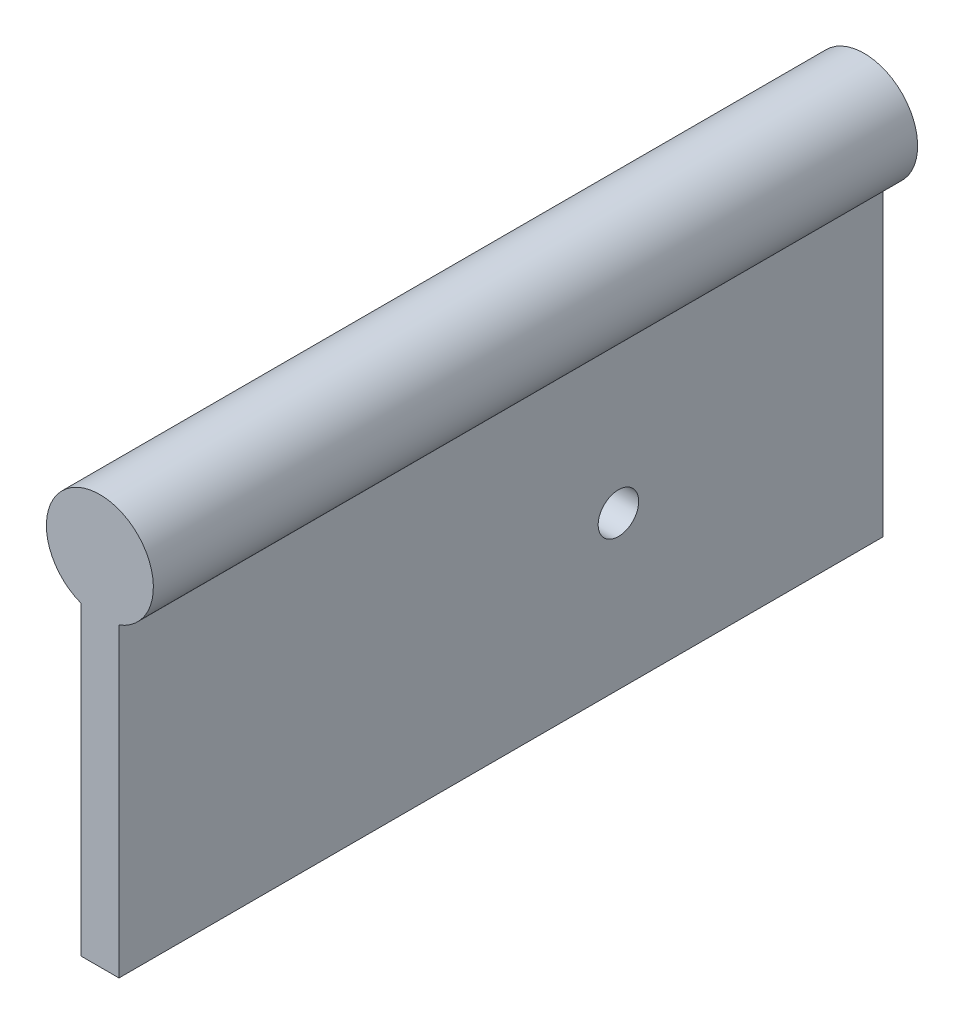
from build123d import *

# Parameters (mm, degrees)
SKETCH1_W           = 40
SKETCH1_H           = 100
SKETCH1_R           = 4.8
BOSS_EXTRUDE1_DEPTH = 5
SKETCH1_3_R         = 4.8
BOSS_EXTRUDE2_DEPTH = 5.2
SKETCH2_R           = 2.5
CUT_EXTRUDE1_DEPTH  = 55.809123328
SKETCH3_R           = 2.65
CUT_EXTRUDE2_DEPTH  = 5
CHAMFER1_SIZE       = 0.15
BOSS_EXTRUDE3_DEPTH = 100


with BuildPart() as part:
    # Sketch1 → Boss-Extrude1 (new body)
    # profile 1 of 3: a face of its own
    with BuildSketch(Plane.YZ):
        Rectangle(SKETCH1_W, SKETCH1_H)
        with Locations((0, -15.35)):
            Circle(SKETCH1_R, mode=Mode.SUBTRACT)
        with Locations((0, 15.35)):
            Circle(SKETCH1_R, mode=Mode.SUBTRACT)
    # profile 2 of 3: a face of its own
    with BuildSketch(Plane.YZ):
        with Locations((0, -15.35)):
            Circle(SKETCH1_R)
    # profile 3 of 3: a face of its own
    with BuildSketch(Plane.YZ):
        with Locations((0, 15.35)):
            Circle(SKETCH1_R)
    extrude(amount=BOSS_EXTRUDE1_DEPTH)

    # Sketch1<3> → Boss-Extrude2 (add)
    with BuildSketch(Plane.YZ):
        with Locations(Location((0, 15.35, 0), (0, 0, 270))):
            Circle(SKETCH1_3_R)
        with Locations(Location((0, -15.35, 0), (0, 0, 270))):
            Circle(SKETCH1_3_R)
    extrude(amount=-BOSS_EXTRUDE2_DEPTH)

    # Sketch2 → Cut-Extrude1 (cut, through all)
    with BuildSketch(Plane(origin=(-5.2, 0, 0), x_dir=(0, -1, 0), z_dir=(-1, 0, 0))):
        with Locations(Location((0, -15.35, 0), (0, 0, 90))):
            Circle(SKETCH2_R)
    extrude(amount=-CUT_EXTRUDE1_DEPTH, mode=Mode.SUBTRACT)

    # Sketch3 → Cut-Extrude2 (cut)
    with BuildSketch(Plane(origin=(5, 0, 0), x_dir=(0, 0, -1), z_dir=(1, 0, 0))):
        with Locations((15.35, 0)):
            Circle(SKETCH3_R)
    extrude(amount=-CUT_EXTRUDE2_DEPTH, mode=Mode.SUBTRACT)

    # Chamfer1
    chamfer1_edges = [part.edges().sort_by_distance(p)[0] for p in [
        (0, 0, -17.85),
    ]]
    chamfer(chamfer1_edges, length=CHAMFER1_SIZE - 0.0001)  # a hair under: the kernel refuses the full size

    # Sketch4 → Boss-Extrude3 (add)
    with BuildSketch(Plane(origin=(0, 0, -50), x_dir=(1, 0, 0), z_dir=(0, 0, -1))):
        with BuildLine():
            Line((5, -20), (0, -20))
            ThreePointArc((0, -20), (2.5, -33.538348415), (5, -20))
        make_face()
    extrude(amount=-BOSS_EXTRUDE3_DEPTH)


solid = part.part
